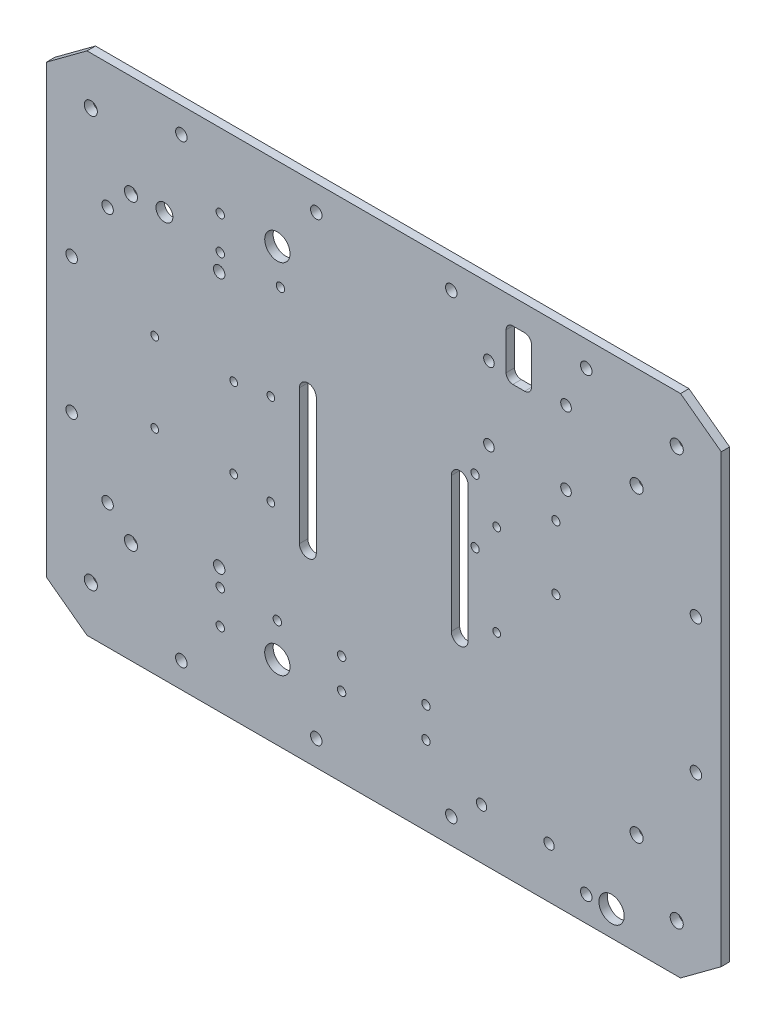
from build123d import *

# Parameters (mm, degrees)
SKETCH1_R                = 2.4638
BOSS_EXTRUDE1_DEPTH      = 3.175
SKETCH5_R                = 3.175
SKETCH5_R_2              = 2.159
SKETCH5_R_3              = 1.4478
CUT_EXTRUDE2_DEPTH       = 159.781746826
SKETCH6_R                = 2.159
CUT_EXTRUDE3_DEPTH       = 159.781746826
SKETCH5_3_R              = 1.45415
CUT_EXTRUDE4_DEPTH       = 159.781746826
SKETCH5_4_R              = 1.5875
SKETCH5_4_R_2            = 4.7625
CUT_EXTRUDE5_DEPTH       = 159.781746826
SKETCH5_5_R              = 1.5875
CUT_EXTRUDE6_DEPTH       = 2.54
SKETCH5_6_R              = 1.5875
CUT_EXTRUDE7_DEPTH       = 159.781746826
CUT_EXTRUDE8_DEPTH       = 7.62
CUT_EXTRUDE8_DEPTH_BACK  = 2.54
SKETCH5_7_W              = 9.525
SKETCH5_7_H              = 19.05
SKETCH5_7_R              = 1.5875
SKETCH5_9_R              = 1.5875
CUT_EXTRUDE9_DEPTH       = 159.781746826
CUT_EXTRUDE17_DEPTH      = 159.781746826
CUT_EXTRUDE17_DEPTH_BACK = 159.781746826
SKETCH5_15_W             = 9.525
SKETCH5_15_H             = 19.05
FILLET1_R                = 2.54
FILLET2_R                = 2.54
SKETCH2_R                = 1.9431
CUT_EXTRUDE20_DEPTH      = 159.781746826
FILLET3_R                = 2.54
FILLET4_R                = 2.54
SKETCH9_R                = 1.55
SKETCH9_R_2              = 2
CUT_EXTRUDE18_DEPTH      = 159.781746826
SKETCH3_R                = 1.5875
CUT_EXTRUDE19_DEPTH      = 976.122


with BuildPart() as part:
    # Sketch1 → Boss-Extrude1 (new body)
    with BuildSketch(Plane.XY):
        Polygon((-111.686526805, -95.25), (-127, -83.918625912), (-127, 83.918625912), (-111.686526805, 95.25), (111.686526805, 95.25), (127, 83.918625912), (127, -83.918625912), (111.686526805, -95.25), align=None)
        with Locations((-95.147512794, 56.885632681)):
            Circle(SKETCH1_R, mode=Mode.SUBTRACT)
        with Locations((-110.256011578, 77.303596941)):
            Circle(SKETCH1_R, mode=Mode.SUBTRACT)
        with Locations((110.256011578, 77.303596941)):
            Circle(SKETCH1_R, mode=Mode.SUBTRACT)
        with Locations((95.147512794, 56.885632681)):
            Circle(SKETCH1_R, mode=Mode.SUBTRACT)
        with Locations((-110.256011578, -77.303596941)):
            Circle(SKETCH1_R, mode=Mode.SUBTRACT)
        with Locations((-95.147512794, -56.885632681)):
            Circle(SKETCH1_R, mode=Mode.SUBTRACT)
        with Locations((110.256011578, -77.303596941)):
            Circle(SKETCH1_R, mode=Mode.SUBTRACT)
        with Locations((95.147512794, -56.885632681)):
            Circle(SKETCH1_R, mode=Mode.SUBTRACT)
    extrude(amount=BOSS_EXTRUDE1_DEPTH)

    # Sketch5 → Cut-Extrude2 (cut, through all)
    with BuildSketch(Plane(origin=(0, 0, 0), x_dir=(-1, 0, 0), z_dir=(0, 0, -1))):
        with Locations((82.55, 57.21604)):
            Circle(SKETCH5_R)
        with Locations((61.9506, -48.13554)):
            Circle(SKETCH5_R_2)
        with Locations((103.9495, -48.13554)):
            Circle(SKETCH5_R_2)
        with Locations((103.9495, 48.13554)):
            Circle(SKETCH5_R_2)
        with Locations((61.9506, 48.13554)):
            Circle(SKETCH5_R_2)
        with BuildLine():
            Line((-31.75, 25.4), (-31.75, -25.4))
            ThreePointArc((-31.75, -25.4), (-28.575, -28.575), (-25.4, -25.4))
            Line((-25.4, -25.4), (-25.4, 25.4))
            ThreePointArc((-25.4, 25.4), (-28.575, 28.575), (-31.75, 25.4))
        make_face()
        with Locations((86.197426463, 15.03413)):
            Circle(SKETCH5_R_3)
        with Locations((56.479426463, 15.03413)):
            Circle(SKETCH5_R_3)
        with Locations((56.479426463, -15.03413)):
            Circle(SKETCH5_R_3)
        with Locations((86.197426463, -15.03413)):
            Circle(SKETCH5_R_3)
        with BuildLine():
            ThreePointArc((31.75, 25.4), (28.575, 28.575), (25.4, 25.4))
            Line((25.4, 25.4), (25.4, -25.4))
            ThreePointArc((25.4, -25.4), (28.575, -28.575), (31.75, -25.4))
            Line((31.75, -25.4), (31.75, 25.4))
        make_face()
    extrude(amount=-CUT_EXTRUDE2_DEPTH, mode=Mode.SUBTRACT)

    # Sketch6 → Cut-Extrude3 (cut, through all)
    with BuildSketch(Plane(origin=(0, 0, 0), x_dir=(-1, 0, 0), z_dir=(0, 0, -1))):
        with Locations((-76.2, -85.725)):
            Circle(SKETCH6_R)
        with Locations((-25.4, -85.725)):
            Circle(SKETCH6_R)
        with Locations((25.4, -85.725)):
            Circle(SKETCH6_R)
        with Locations((76.2, -85.725)):
            Circle(SKETCH6_R)
        with Locations((76.2, 85.725)):
            Circle(SKETCH6_R)
        with Locations((25.4, 85.725)):
            Circle(SKETCH6_R)
        with Locations((-25.4, 85.725)):
            Circle(SKETCH6_R)
        with Locations((-76.2, 85.725)):
            Circle(SKETCH6_R)
        with Locations((117.475, -25.4)):
            Circle(SKETCH6_R)
        with Locations((117.475, 25.4)):
            Circle(SKETCH6_R)
        with Locations((-117.475, 25.4)):
            Circle(SKETCH6_R)
        with Locations((-117.475, -25.4)):
            Circle(SKETCH6_R)
    extrude(amount=-CUT_EXTRUDE3_DEPTH, mode=Mode.SUBTRACT)

    # Sketch5<3> → Cut-Extrude4 (cut, through all)
    with BuildSketch(Plane(origin=(0, 0, 0), x_dir=(-1, 0, 0), z_dir=(0, 0, -1))):
        with Locations((-42.5, 17.2)):
            Circle(SKETCH5_3_R)
        with Locations((-42.5, -17.2)):
            Circle(SKETCH5_3_R)
        with Locations((42.5, -17.2)):
            Circle(SKETCH5_3_R)
        with Locations((42.5, 17.2)):
            Circle(SKETCH5_3_R)
    extrude(amount=-CUT_EXTRUDE4_DEPTH, mode=Mode.SUBTRACT)

    # Sketch5<4> → Cut-Extrude5 (cut, through all)
    with BuildSketch(Plane(origin=(0, 0, 0), x_dir=(-1, 0, 0), z_dir=(0, 0, -1))):
        with Locations((61.544630637, -54.61)):
            Circle(SKETCH5_4_R)
        with Locations((61.544630637, -67.31)):
            Circle(SKETCH5_4_R)
        with Locations((-85.725, -85.725)):
            Circle(SKETCH5_4_R_2)
        with Locations((61.544630637, 54.61)):
            Circle(SKETCH5_4_R)
        with Locations((40.055369363, -67.31)):
            Circle(SKETCH5_4_R_2)
        with Locations((61.544630637, 67.31)):
            Circle(SKETCH5_4_R)
        with Locations((40.055369363, 67.31)):
            Circle(SKETCH5_4_R_2)
    extrude(amount=-CUT_EXTRUDE5_DEPTH, mode=Mode.SUBTRACT)

    # Sketch5<5> → Cut-Extrude6 (cut)
    with BuildSketch(Plane(origin=(0, 0, 0), x_dir=(-1, 0, 0), z_dir=(0, 0, -1))):
        with Locations((38.886108088, 54.61)):
            Circle(SKETCH5_5_R)
    extrude(amount=-CUT_EXTRUDE6_DEPTH, mode=Mode.SUBTRACT)

    # Sketch5<6> → Cut-Extrude7 (cut, through all)
    with BuildSketch(Plane(origin=(0, 0, 0), x_dir=(-1, 0, 0), z_dir=(0, 0, -1))):
        with Locations((38.886108088, 54.61)):
            Circle(SKETCH5_6_R)
    extrude(amount=-CUT_EXTRUDE7_DEPTH, mode=Mode.SUBTRACT)

    # Sketch5<7> → Cut-Extrude8 (cut, two sides: drawn at the far end of the back side and taken through both)
    with BuildSketch(Plane(origin=(0, 0, 0), x_dir=(-1, 0, 0), z_dir=(0, 0, -1)).offset(-CUT_EXTRUDE8_DEPTH_BACK)):
        with Locations((-50.8, 76.2)):
            Rectangle(SKETCH5_7_W, SKETCH5_7_H)
        with Locations((40.055369363, -54.61)):
            Circle(SKETCH5_7_R)
    extrude(amount=CUT_EXTRUDE8_DEPTH + CUT_EXTRUDE8_DEPTH_BACK, mode=Mode.SUBTRACT)

    # Sketch5<9> → Cut-Extrude9 (cut, through all)
    with BuildSketch(Plane(origin=(0, 0, 0), x_dir=(-1, 0, 0), z_dir=(0, 0, -1))):
        with Locations((40.055369363, -54.61)):
            Circle(SKETCH5_9_R)
    extrude(amount=-CUT_EXTRUDE9_DEPTH, mode=Mode.SUBTRACT)

    # Sketch5<15> → Cut-Extrude17 (cut, two sides: drawn at the far end of the back side and taken through both)
    with BuildSketch(Plane(origin=(0, 0, 0), x_dir=(-1, 0, 0), z_dir=(0, 0, -1)).offset(-CUT_EXTRUDE17_DEPTH_BACK)):
        with Locations((-50.8, 76.2)):
            Rectangle(SKETCH5_15_W, SKETCH5_15_H)
    extrude(amount=CUT_EXTRUDE17_DEPTH + CUT_EXTRUDE17_DEPTH_BACK, mode=Mode.SUBTRACT)

    # Fillet1
    fillet1_edges = [part.edges().sort_by_distance(p)[0] for p in [
        (55.5625, 85.725, 1.5875),
    ]]
    fillet(fillet1_edges, radius=FILLET1_R)

    # Fillet2
    fillet2_edges = [part.edges().sort_by_distance(p)[0] for p in [
        (46.0375, 85.725, 1.5875),
    ]]
    fillet(fillet2_edges, radius=FILLET2_R)

    # Sketch2 → Cut-Extrude20 (cut, through all)
    with BuildSketch(Plane.XY.offset(3.175)):
        with Locations((62.199353496, -76.2)):
            Circle(SKETCH2_R)
        with Locations((36.799353496, -76.2)):
            Circle(SKETCH2_R)
    extrude(amount=-CUT_EXTRUDE20_DEPTH, mode=Mode.SUBTRACT)

    # Fillet3
    fillet3_edges = [part.edges().sort_by_distance(p)[0] for p in [
        (46.0375, 66.675, 1.5875),
    ]]
    fillet(fillet3_edges, radius=FILLET3_R)

    # Fillet4
    fillet4_edges = [part.edges().sort_by_distance(p)[0] for p in [
        (55.5625, 66.675, 1.5875),
    ]]
    fillet(fillet4_edges, radius=FILLET4_R)

    # Sketch9 → Cut-Extrude18 (cut, through all)
    with BuildSketch(Plane.XY.offset(3.175)):
        with Locations((34.370000094, 30.350000006)):
            Circle(SKETCH9_R)
        with Locations((64.77, 30.350000006)):
            Circle(SKETCH9_R)
        with Locations((64.77, 6.35)):
            Circle(SKETCH9_R)
        with Locations((34.370000094, 6.35)):
            Circle(SKETCH9_R)
        with Locations((68.58, 69.85)):
            Circle(SKETCH9_R_2)
        with Locations((39.58, 69.85)):
            Circle(SKETCH9_R_2)
        with Locations((39.58, 42.35)):
            Circle(SKETCH9_R_2)
        with Locations((68.58, 42.35)):
            Circle(SKETCH9_R_2)
    extrude(amount=-CUT_EXTRUDE18_DEPTH, mode=Mode.SUBTRACT)

    # Sketch3 → Cut-Extrude19 (cut)
    with BuildSketch(Plane.XY.offset(3.175)):
        with Locations((-15.875, -65.560310834)):
            Circle(SKETCH3_R)
        with Locations((15.875, -65.560310834)):
            Circle(SKETCH3_R)
        with Locations((-15.875, -54.130310834)):
            Circle(SKETCH3_R)
        with Locations((15.875, -54.130310834)):
            Circle(SKETCH3_R)
    extrude(amount=-CUT_EXTRUDE19_DEPTH, mode=Mode.SUBTRACT)


solid = part.part
